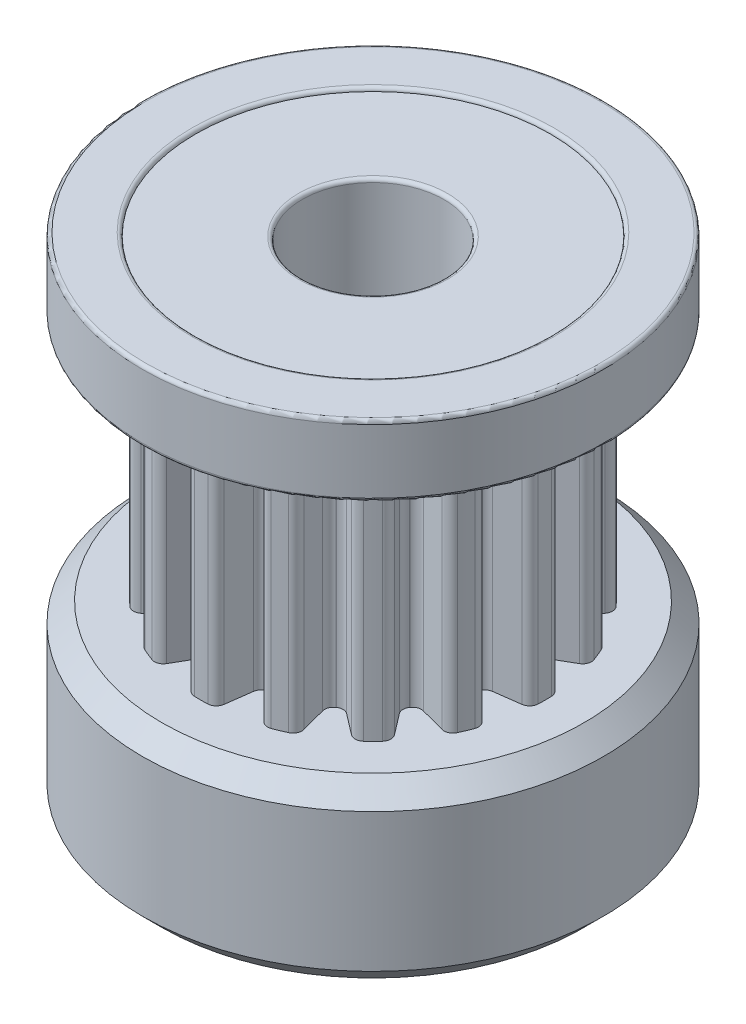
from build123d import *

# Parameters (mm, degrees)
SKETCH1_R           = 6.5
BOSS_EXTRUDE1_DEPTH = 5
BOSS_EXTRUDE2_DEPTH = 7
SKETCH3_R           = 6.5
BOSS_EXTRUDE3_DEPTH = 2
SKETCH4_R           = 2
CUT_EXTRUDE1_DEPTH  = 17.748134224
SKETCH5_R           = 5
SKETCH5_R_2         = 2
CUT_EXTRUDE2_DEPTH  = 0.1
FILLET1_R           = 0.1
CHAMFER1_SIZE       = 0.55
SKETCH6_R           = 1.25
CUT_EXTRUDE3_DEPTH  = 17.748134302
SKETCH7_R           = 1.25
CUT_EXTRUDE4_DEPTH  = 17.748134309


with BuildPart() as part:
    # Sketch1 → Boss-Extrude1 (new body)
    with BuildSketch(Plane(origin=(0, 0, 0), x_dir=(1, 0, 0), z_dir=(0, 1, 0))):
        with Locations(Location((0, 0, 0), (0, 0, 270))):
            Circle(SKETCH1_R)
    extrude(amount=BOSS_EXTRUDE1_DEPTH)

    # Sketch2 → Boss-Extrude2 (add)
    with BuildSketch(Plane(origin=(0, 5, 0), x_dir=(1, 0, 0), z_dir=(0, 1, 0))):
        with BuildLine():
            Line((-0.427211204, 4.629569014), (-0.525715091, 3.891427113))
            ThreePointArc((-0.525715091, 3.891427113), (-0.591352421, 3.75327813), (-0.725173432, 3.679215065))
            Line((-0.725173432, 3.679215065), (-0.738001758, 3.676663352))
            ThreePointArc((-0.738001758, 3.676663352), (-0.889978959, 3.693877619), (-1.003487272, 3.796392318))
            Line((-1.003487272, 3.796392318), (-1.376967673, 4.440650706))
            ThreePointArc((-1.376967673, 4.440650706), (-1.508498642, 4.550463779), (-1.679842911, 4.549794259))
            ThreePointArc((-1.679842911, 4.549794259), (-1.856014647, 4.480815733), (-2.02936206, 4.405018687))
            ThreePointArc((-2.02936206, 4.405018687), (-2.150994177, 4.284333415), (-2.166351048, 4.113677406))
            Line((-2.166351048, 4.113677406), (-1.974882097, 3.394027407))
            ThreePointArc((-1.974882097, 3.394027407), (-1.982655756, 3.24127607), (-2.077947541, 3.121639636))
            Line((-2.077947541, 3.121639636), (-2.088822871, 3.114372973))
            ThreePointArc((-2.088822871, 3.114372973), (-2.235819111, 3.072117725), (-2.379917795, 3.123391206))
            Line((-2.379917795, 3.123391206), (-2.971515704, 3.575683583))
            ThreePointArc((-2.971515704, 3.575683583), (-3.135058118, 3.626802911), (-3.293103366, 3.560613742))
            ThreePointArc((-3.293103366, 3.560613742), (-3.429467889, 3.429467889), (-3.560613742, 3.293103366))
            ThreePointArc((-3.560613742, 3.293103366), (-3.626802911, 3.135058118), (-3.575683583, 2.971515704))
            Line((-3.575683583, 2.971515704), (-3.123391206, 2.379917795))
            ThreePointArc((-3.123391206, 2.379917795), (-3.072117725, 2.235819111), (-3.114372973, 2.088822871))
            Line((-3.114372973, 2.088822871), (-3.121639636, 2.077947541))
            ThreePointArc((-3.121639636, 2.077947541), (-3.24127607, 1.982655756), (-3.394027407, 1.974882097))
            Line((-3.394027407, 1.974882097), (-4.113677406, 2.166351048))
            ThreePointArc((-4.113677406, 2.166351048), (-4.284333415, 2.150994177), (-4.405018687, 2.02936206))
            ThreePointArc((-4.405018687, 2.02936206), (-4.480815733, 1.856014647), (-4.549794259, 1.679842911))
            ThreePointArc((-4.549794259, 1.679842911), (-4.550463779, 1.508498642), (-4.440650706, 1.376967673))
            Line((-4.440650706, 1.376967673), (-3.796392318, 1.003487272))
            ThreePointArc((-3.796392318, 1.003487272), (-3.693877619, 0.889978959), (-3.676663352, 0.738001758))
            Line((-3.676663352, 0.738001758), (-3.679215065, 0.725173432))
            ThreePointArc((-3.679215065, 0.725173432), (-3.75327813, 0.591352421), (-3.891427113, 0.525715091))
            Line((-3.891427113, 0.525715091), (-4.629569014, 0.427211204))
            ThreePointArc((-4.629569014, 0.427211204), (-4.781357787, 0.347716078), (-4.846309844, 0.189158401))
            ThreePointArc((-4.846309844, 0.189158401), (-4.85, 0), (-4.846309844, -0.189158401))
            ThreePointArc((-4.846309844, -0.189158401), (-4.781357787, -0.347716078), (-4.629569014, -0.427211204))
            Line((-4.629569014, -0.427211204), (-3.891427113, -0.525715091))
            ThreePointArc((-3.891427113, -0.525715091), (-3.75327813, -0.591352421), (-3.679215065, -0.725173432))
            Line((-3.679215065, -0.725173432), (-3.676663352, -0.738001758))
            ThreePointArc((-3.676663352, -0.738001758), (-3.693877619, -0.889978959), (-3.796392318, -1.003487272))
            Line((-3.796392318, -1.003487272), (-4.440650706, -1.376967673))
            ThreePointArc((-4.440650706, -1.376967673), (-4.550463779, -1.508498642), (-4.549794259, -1.679842911))
            ThreePointArc((-4.549794259, -1.679842911), (-4.480815733, -1.856014647), (-4.405018687, -2.02936206))
            ThreePointArc((-4.405018687, -2.02936206), (-4.284333415, -2.150994177), (-4.113677406, -2.166351048))
            Line((-4.113677406, -2.166351048), (-3.394027407, -1.974882097))
            ThreePointArc((-3.394027407, -1.974882097), (-3.24127607, -1.982655756), (-3.121639636, -2.077947541))
            Line((-3.121639636, -2.077947541), (-3.114372973, -2.088822871))
            ThreePointArc((-3.114372973, -2.088822871), (-3.072117725, -2.235819111), (-3.123391206, -2.379917795))
            Line((-3.123391206, -2.379917795), (-3.575683583, -2.971515704))
            ThreePointArc((-3.575683583, -2.971515704), (-3.626802911, -3.135058118), (-3.560613742, -3.293103366))
            ThreePointArc((-3.560613742, -3.293103366), (-3.429467889, -3.429467889), (-3.293103366, -3.560613742))
            ThreePointArc((-3.293103366, -3.560613742), (-3.135058118, -3.626802911), (-2.971515704, -3.575683583))
            Line((-2.971515704, -3.575683583), (-2.379917795, -3.123391206))
            ThreePointArc((-2.379917795, -3.123391206), (-2.235819111, -3.072117725), (-2.088822871, -3.114372973))
            Line((-2.088822871, -3.114372973), (-2.077947541, -3.121639636))
            ThreePointArc((-2.077947541, -3.121639636), (-1.982655756, -3.24127607), (-1.974882097, -3.394027407))
            Line((-1.974882097, -3.394027407), (-2.166351048, -4.113677406))
            ThreePointArc((-2.166351048, -4.113677406), (-2.150994177, -4.284333415), (-2.02936206, -4.405018687))
            ThreePointArc((-2.02936206, -4.405018687), (-1.856014647, -4.480815733), (-1.679842911, -4.549794259))
            ThreePointArc((-1.679842911, -4.549794259), (-1.508498642, -4.550463779), (-1.376967673, -4.440650706))
            Line((-1.376967673, -4.440650706), (-1.003487272, -3.796392318))
            ThreePointArc((-1.003487272, -3.796392318), (-0.889978959, -3.693877619), (-0.738001758, -3.676663352))
            Line((-0.738001758, -3.676663352), (-0.725173432, -3.679215065))
            ThreePointArc((-0.725173432, -3.679215065), (-0.591352421, -3.75327813), (-0.525715091, -3.891427113))
            Line((-0.525715091, -3.891427113), (-0.427211204, -4.629569014))
            ThreePointArc((-0.427211204, -4.629569014), (-0.347716078, -4.781357787), (-0.189158401, -4.846309844))
            ThreePointArc((-0.189158401, -4.846309844), (0, -4.85), (0.189158401, -4.846309844))
            ThreePointArc((0.189158401, -4.846309844), (0.347716078, -4.781357787), (0.427211204, -4.629569014))
            Line((0.427211204, -4.629569014), (0.525715091, -3.891427113))
            ThreePointArc((0.525715091, -3.891427113), (0.591352421, -3.75327813), (0.725173432, -3.679215065))
            Line((0.725173432, -3.679215065), (0.738001758, -3.676663352))
            ThreePointArc((0.738001758, -3.676663352), (0.889978959, -3.693877619), (1.003487272, -3.796392318))
            Line((1.003487272, -3.796392318), (1.376967673, -4.440650706))
            ThreePointArc((1.376967673, -4.440650706), (1.508498642, -4.550463779), (1.679842911, -4.549794259))
            ThreePointArc((1.679842911, -4.549794259), (1.856014647, -4.480815733), (2.02936206, -4.405018687))
            ThreePointArc((2.02936206, -4.405018687), (2.150994177, -4.284333415), (2.166351048, -4.113677406))
            Line((2.166351048, -4.113677406), (1.974882097, -3.394027407))
            ThreePointArc((1.974882097, -3.394027407), (1.982655756, -3.24127607), (2.077947541, -3.121639636))
            Line((2.077947541, -3.121639636), (2.088822871, -3.114372973))
            ThreePointArc((2.088822871, -3.114372973), (2.235819111, -3.072117725), (2.379917795, -3.123391206))
            Line((2.379917795, -3.123391206), (2.971515704, -3.575683583))
            ThreePointArc((2.971515704, -3.575683583), (3.135058118, -3.626802911), (3.293103366, -3.560613742))
            ThreePointArc((3.293103366, -3.560613742), (3.429467889, -3.429467889), (3.560613742, -3.293103366))
            ThreePointArc((3.560613742, -3.293103366), (3.626802911, -3.135058118), (3.575683583, -2.971515704))
            Line((3.575683583, -2.971515704), (3.123391206, -2.379917795))
            ThreePointArc((3.123391206, -2.379917795), (3.072117725, -2.235819111), (3.114372973, -2.088822871))
            Line((3.114372973, -2.088822871), (3.121639636, -2.077947541))
            ThreePointArc((3.121639636, -2.077947541), (3.24127607, -1.982655756), (3.394027407, -1.974882097))
            Line((3.394027407, -1.974882097), (4.113677406, -2.166351048))
            ThreePointArc((4.113677406, -2.166351048), (4.284333415, -2.150994177), (4.405018687, -2.02936206))
            ThreePointArc((4.405018687, -2.02936206), (4.480815733, -1.856014647), (4.549794259, -1.679842911))
            ThreePointArc((4.549794259, -1.679842911), (4.550463779, -1.508498642), (4.440650706, -1.376967673))
            Line((4.440650706, -1.376967673), (3.796392318, -1.003487272))
            ThreePointArc((3.796392318, -1.003487272), (3.693877619, -0.889978959), (3.676663352, -0.738001758))
            Line((3.676663352, -0.738001758), (3.679215065, -0.725173432))
            ThreePointArc((3.679215065, -0.725173432), (3.75327813, -0.591352421), (3.891427113, -0.525715091))
            Line((3.891427113, -0.525715091), (4.629569014, -0.427211204))
            ThreePointArc((4.629569014, -0.427211204), (4.781357787, -0.347716078), (4.846309844, -0.189158401))
            ThreePointArc((4.846309844, -0.189158401), (4.85, 0), (4.846309844, 0.189158401))
            ThreePointArc((4.846309844, 0.189158401), (4.781357787, 0.347716078), (4.629569014, 0.427211204))
            Line((4.629569014, 0.427211204), (3.891427113, 0.525715091))
            ThreePointArc((3.891427113, 0.525715091), (3.75327813, 0.591352421), (3.679215065, 0.725173432))
            Line((3.679215065, 0.725173432), (3.676663352, 0.738001758))
            ThreePointArc((3.676663352, 0.738001758), (3.693877619, 0.889978959), (3.796392318, 1.003487272))
            Line((3.796392318, 1.003487272), (4.440650706, 1.376967673))
            ThreePointArc((4.440650706, 1.376967673), (4.550463779, 1.508498642), (4.549794259, 1.679842911))
            ThreePointArc((4.549794259, 1.679842911), (4.480815733, 1.856014647), (4.405018687, 2.02936206))
            ThreePointArc((4.405018687, 2.02936206), (4.284333415, 2.150994177), (4.113677406, 2.166351048))
            Line((4.113677406, 2.166351048), (3.394027407, 1.974882097))
            ThreePointArc((3.394027407, 1.974882097), (3.24127607, 1.982655756), (3.121639636, 2.077947541))
            Line((3.121639636, 2.077947541), (3.114372973, 2.088822871))
            ThreePointArc((3.114372973, 2.088822871), (3.072117725, 2.235819111), (3.123391206, 2.379917795))
            Line((3.123391206, 2.379917795), (3.575683583, 2.971515704))
            ThreePointArc((3.575683583, 2.971515704), (3.626802911, 3.135058118), (3.560613742, 3.293103366))
            ThreePointArc((3.560613742, 3.293103366), (3.429467889, 3.429467889), (3.293103366, 3.560613742))
            ThreePointArc((3.293103366, 3.560613742), (3.135058118, 3.626802911), (2.971515704, 3.575683583))
            Line((2.971515704, 3.575683583), (2.379917795, 3.123391206))
            ThreePointArc((2.379917795, 3.123391206), (2.235819111, 3.072117725), (2.088822871, 3.114372973))
            Line((2.088822871, 3.114372973), (2.077947541, 3.121639636))
            ThreePointArc((2.077947541, 3.121639636), (1.982655756, 3.24127607), (1.974882097, 3.394027407))
            Line((1.974882097, 3.394027407), (2.166351048, 4.113677406))
            ThreePointArc((2.166351048, 4.113677406), (2.150994177, 4.284333415), (2.02936206, 4.405018687))
            ThreePointArc((2.02936206, 4.405018687), (1.856014647, 4.480815733), (1.679842911, 4.549794259))
            ThreePointArc((1.679842911, 4.549794259), (1.508498642, 4.550463779), (1.376967673, 4.440650706))
            Line((1.376967673, 4.440650706), (1.003487272, 3.796392318))
            ThreePointArc((1.003487272, 3.796392318), (0.889978959, 3.693877619), (0.738001758, 3.676663352))
            Line((0.738001758, 3.676663352), (0.725173432, 3.679215065))
            ThreePointArc((0.725173432, 3.679215065), (0.591352421, 3.75327813), (0.525715091, 3.891427113))
            Line((0.525715091, 3.891427113), (0.427211204, 4.629569014))
            ThreePointArc((0.427211204, 4.629569014), (0.347716078, 4.781357787), (0.189158401, 4.846309844))
            ThreePointArc((0.189158401, 4.846309844), (0, 4.85), (-0.189158401, 4.846309844))
            ThreePointArc((-0.189158401, 4.846309844), (-0.347716078, 4.781357787), (-0.427211204, 4.629569014))
        make_face()
    extrude(amount=BOSS_EXTRUDE2_DEPTH)

    # Sketch3 → Boss-Extrude3 (add)
    with BuildSketch(Plane(origin=(0, 12, 0), x_dir=(1, 0, 0), z_dir=(0, 1, 0))):
        with Locations(Location((0, 0, 0), (0, 0, 270))):
            Circle(SKETCH3_R)
    extrude(amount=BOSS_EXTRUDE3_DEPTH)

    # Sketch4 → Cut-Extrude1 (cut, through all)
    with BuildSketch(Plane(origin=(0, 14, 0), x_dir=(1, 0, 0), z_dir=(0, 1, 0))):
        with Locations(Location((0, 0, 0), (0, 0, 270))):
            Circle(SKETCH4_R)
    extrude(amount=-CUT_EXTRUDE1_DEPTH, mode=Mode.SUBTRACT)

    # Sketch5 → Cut-Extrude2 (cut)
    with BuildSketch(Plane(origin=(0, 14, 0), x_dir=(1, 0, 0), z_dir=(0, 1, 0))):
        with Locations(Location((0, 0, 0), (0, 0, 270))):
            Circle(SKETCH5_R)
        with Locations(Location((0, 0, 0), (0, 0, 270))):
            Circle(SKETCH5_R_2, mode=Mode.SUBTRACT)
    extrude(amount=-CUT_EXTRUDE2_DEPTH, mode=Mode.SUBTRACT)

    # Fillet1
    fillet1_edges = [part.edges().sort_by_distance(p)[0] for p in [
        (0, 12, -6.5),
        (0, 14, -6.5),
        (0, 13.9, -2),
        (0, 14, -5),
    ]]
    fillet(fillet1_edges, radius=FILLET1_R - 0.0001)  # a hair under: the kernel refuses the full size

    # Chamfer1
    chamfer1_edges = [part.edges().sort_by_distance(p)[0] for p in [
        (0, 0, -6.5),
        (0, 5, -6.5),
    ]]
    chamfer(chamfer1_edges, length=CHAMFER1_SIZE)

    # Sketch6 → Cut-Extrude3 (cut, through all)
    with BuildSketch(Plane.XY):
        with Locations((0, 2.5)):
            Circle(SKETCH6_R)
    extrude(amount=-CUT_EXTRUDE3_DEPTH, mode=Mode.SUBTRACT)

    # Sketch7 → Cut-Extrude4 (cut, through all)
    with BuildSketch(Plane(origin=(0, 0, 0), x_dir=(0, 0, -1), z_dir=(1, 0, 0))):
        with Locations((0, 2.5)):
            Circle(SKETCH7_R)
    extrude(amount=-CUT_EXTRUDE4_DEPTH, mode=Mode.SUBTRACT)


solid = part.part
